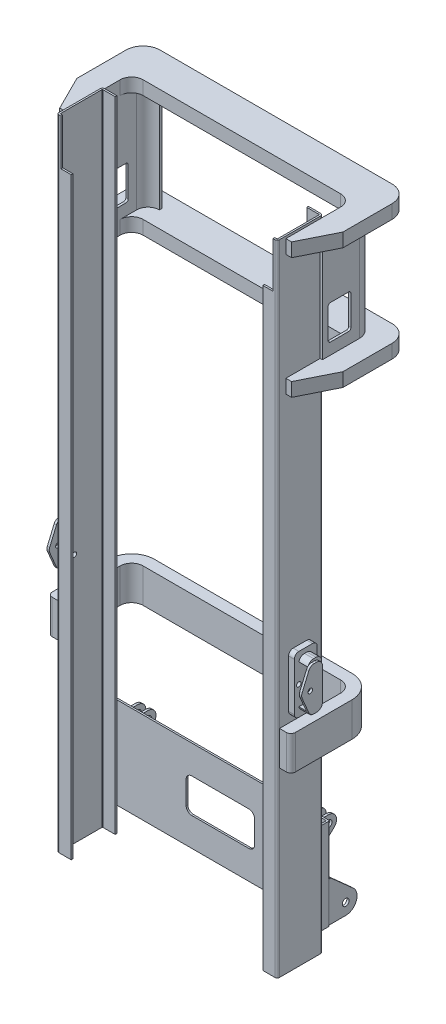
from build123d import *
from build123d.topology import SkipClean

# Parameters (mm, degrees)
EXTRUDE_THIN1_DEPTH     = 1400
CUT_EXTRUDE1_REACH      = 1496.419
SKETCH2_W               = 45
SKETCH2_H               = 200
EXTRUDE_THIN2_START     = -75
EXTRUDE_THIN2_DEPTH     = 400
FILLET2_R               = 5
CUT_EXTRUDE2_REACH      = 1502.296
SKETCH4_W               = 300
SKETCH4_H               = 150
FILLET3_R               = 25
BOSS_EXTRUDE1_START     = -50
SKETCH5_R               = 15
BOSS_EXTRUDE1_DEPTH     = 10
LPATTERN1_COUNT         = 2
LPATTERN1_PITCH         = 45
MIRROR5_START           = -50
MIRROR5_COPY_1_SKETCH_R = 15
MIRROR5_COPY_1_DEPTH    = 10
BOSS_EXTRUDE2_START     = -5
SKETCH6_R               = 15
BOSS_EXTRUDE2_DEPTH     = 10
BOSS_EXTRUDE3_START     = -600
BOSS_EXTRUDE3_DEPTH     = 60
LPATTERN3_COUNT         = 2
LPATTERN3_PITCH         = 530
EXTRUDE_THIN5_REACH     = 2366.397
CUT_EXTRUDE3_REACH      = 1807.73
BOSS_EXTRUDE4_DEPTH     = 25
SKETCH13_W              = 60
SKETCH13_H              = 210
BOSS_EXTRUDE5_DEPTH     = 40
SKETCH14_W              = 20
SKETCH14_H              = 170
CUT_EXTRUDE4_DEPTH      = 40
BOSS_EXTRUDE6_DEPTH     = 10
CUT_EXTRUDE5_REACH      = 1847.201
SKETCH16_R              = 10
FILLET4_R               = 25
FILLET5_R               = 25
MIRROR8_START           = -483
MIRROR8_OUTLINE_R       = 10
MIRROR8_DEPTH           = 966
MIRROR8_START_2         = 483
MIRROR8_2_OUTLINE_R     = 10
MIRROR8_2_DEPTH         = 25
MIRROR8_START_3         = 508
MIRROR8_3_DEPTH         = 40
MIRROR8_START_4         = 548
MIRROR8_4_OUTLINE_R     = 10
MIRROR8_4_DEPTH         = 10
BOSS_EXTRUDE7_START     = 175
SKETCH17_W              = 25
SKETCH17_H              = 60
BOSS_EXTRUDE7_DEPTH     = 150
FILLET6_R               = 20
SKETCH18_W              = 40
SKETCH18_H              = 160
CUT_EXTRUDE6_DEPTH      = 256


# Read off the part's stored shape, not the designer's step: Mirror8
with BuildPart() as part:
    # Sketch1 → Extrude-Thin1 (new, symmetric)
    with BuildSketch(Plane(origin=(0, 0, 0), x_dir=(1, 0, 0), z_dir=(0, 1, 0))):
        with BuildLine():
            Line((420, 100), (473, 100))
            ThreePointArc((473, 100), (480.071067812, 97.071067812), (483, 90))
            Line((483, 90), (483, -90))
            ThreePointArc((483, -90), (480.071067812, -97.071067812), (473, -100))
            Line((473, -100), (420, -100))
            Line((420, -100), (420, -92.5))
            Line((420, -92.5), (473, -92.5))
            ThreePointArc((473, -92.5), (474.767766953, -91.767766953), (475.5, -90))
            Line((475.5, -90), (475.5, 90))
            ThreePointArc((475.5, 90), (474.767766953, 91.767766953), (473, 92.5))
            Line((473, 92.5), (420, 92.5))
            Line((420, 92.5), (420, 100))
        make_face()
    extrude(amount=EXTRUDE_THIN1_DEPTH, both=True)

    # Sketch2 → Cut-Extrude1 (cut, up to next)
    with BuildSketch(Plane.XY.offset(100), mode=Mode.PRIVATE) as cut_extrude1_sk1:
        with Locations((442.5, 1300)):
            Rectangle(SKETCH2_W, SKETCH2_H)
    cut_extrude1_tool1 = extrude(cut_extrude1_sk1.sketch, amount=-CUT_EXTRUDE1_REACH, mode=Mode.PRIVATE) & part.part
    add(cut_extrude1_tool1.solids().sort_by_distance((442.5, 1300, 100))[0], mode=Mode.SUBTRACT)


with BuildPart() as body_2:
    # Mirror4: mirrored copy
    add(part.part.mirror(Plane(origin=(0, 0, 0), x_dir=(0, 0, 1), z_dir=(1, 0, 0))))


with BuildPart() as part_1:
    add(part.part)

    add(body_2.part)  # Extrude-Thin2 merges body 2
    # Sketch3 → Extrude-Thin2 (add)
    with BuildSketch(Plane.XZ.offset(1400).offset(EXTRUDE_THIN2_START)):
        Polygon((-473, -100), (-473, -140), (473, -140), (473, -100), (465.5, -100), (465.5, -132.5), (-465.5, -132.5), (-465.5, -100), align=None)
    extrude(amount=-EXTRUDE_THIN2_DEPTH)

    # Fillet2
    fillet2_edges = [part_1.edges().sort_by_distance(p)[0] for p in [
        (473, -1125, -140),
        (-473, -1125, -140),
    ]]
    fillet(fillet2_edges, radius=FILLET2_R)

    # Sketch4 → Cut-Extrude2 (cut, up to next)
    with BuildSketch(Plane(origin=(0, 0, -140), x_dir=(-1, 0, 0), z_dir=(0, 0, -1)), mode=Mode.PRIVATE) as cut_extrude2_sk1:
        with Locations((-1.25, -1125)):
            Rectangle(SKETCH4_W, SKETCH4_H)
    cut_extrude2_tool1 = extrude(cut_extrude2_sk1.sketch, amount=-CUT_EXTRUDE2_REACH, mode=Mode.PRIVATE) & part_1.part
    add(cut_extrude2_tool1.solids().sort_by_distance((1.25, -1125, -140))[0], mode=Mode.SUBTRACT)

    # Fillet3
    fillet3_edges = [part_1.edges().sort_by_distance(p)[0] for p in [
        (-148.75, -1050, -136.25),
        (-148.75, -1200, -136.25),
        (151.25, -1200, -136.25),
        (151.25, -1050, -136.25),
    ]]
    fillet(fillet3_edges, radius=FILLET3_R)

    # Sketch5 → Boss-Extrude1 (add)
    with BuildSketch(Plane(origin=(473, 0, 0), x_dir=(0, 0, -1), z_dir=(1, 0, 0)).offset(BOSS_EXTRUDE1_START)):
        with BuildLine():
            Line((140, -950), (185, -950))
            ThreePointArc((185, -950), (217.555636783, -972.149688189), (208.905719078, -1010.56397065))
            Line((208.905719078, -1010.56397065), (140, -1075))
            Line((140, -1075), (140, -950))
        make_face()
        with Locations((185, -985)):
            Circle(SKETCH5_R, mode=Mode.SUBTRACT)
    boss_extrude1 = extrude(amount=-BOSS_EXTRUDE1_DEPTH)

    # LPattern1: Boss-Extrude1 ×2
    with Locations(*[(-i * LPATTERN1_PITCH, 0, 0) for i in range(1, LPATTERN1_COUNT)]):
        add(boss_extrude1)

    # Mirror5: Boss-Extrude1 across plane
    add(boss_extrude1.mirror(Plane(origin=(0, 0, 0), x_dir=(0, 0, 1), z_dir=(1, 0, 0))))

    # Mirror5 copy 1 sketch → Mirror5 copy 1 (add)
    with BuildSketch(Plane(origin=(-428, 0, 0), x_dir=(0, 0, -1), z_dir=(-1, 0, 0)).offset(MIRROR5_START)):
        with BuildLine():
            Line((140, 950), (185, 950))
            ThreePointArc((185, 950), (217.555636783, 972.149688189), (208.905719078, 1010.56397065))
            Line((208.905719078, 1010.56397065), (140, 1075))
            Line((140, 1075), (140, 950))
        make_face()
        with Locations((185, 985)):
            Circle(MIRROR5_COPY_1_SKETCH_R, mode=Mode.SUBTRACT)
    extrude(amount=-MIRROR5_COPY_1_DEPTH)

    # Sketch6 → Boss-Extrude2 (add)
    with BuildSketch(Plane(origin=(473, 0, 0), x_dir=(0, 0, -1), z_dir=(1, 0, 0)).offset(BOSS_EXTRUDE2_START)):
        with BuildLine():
            Line((140, -1325), (215, -1325))
            ThreePointArc((215, -1325), (261.719701801, -1292.812059501), (248.286964333, -1237.690778547))
            Line((248.286964333, -1237.690778547), (150, -1150))
            Line((150, -1150), (140, -1150))
            Line((140, -1150), (140, -1325))
        make_face()
        with Locations((215, -1275)):
            Circle(SKETCH6_R, mode=Mode.SUBTRACT)
    boss_extrude2 = extrude(amount=-BOSS_EXTRUDE2_DEPTH)

    # Mirror6: Boss-Extrude2 across plane
    add(boss_extrude2.mirror(Plane(origin=(0, 0, 0), x_dir=(0, 0, 1), z_dir=(1, 0, 0))))

    # Sketch8 → Boss-Extrude3 (add)
    with BuildSketch(Plane(origin=(0, 1400, 0), x_dir=(1, 0, 0), z_dir=(0, 1, 0)).offset(BOSS_EXTRUDE3_START)):
        with BuildLine():
            Line((-483, -62), (-508, -62))
            Line((-508, -62), (-583, 88))
            Line((-583, 88), (-583, 303))
            ThreePointArc((-583, 303), (-561.033008589, 356.033008589), (-508, 378))
            Line((-508, 378), (508, 378))
            ThreePointArc((508, 378), (561.033008589, 356.033008589), (583, 303))
            Line((583, 303), (583, 88))
            Line((583, 88), (508, -62))
            Line((508, -62), (483, -62))
            Line((483, -62), (483, 178))
            ThreePointArc((483, 178), (468.355339059, 213.355339059), (433, 228))
            Line((433, 228), (-433, 228))
            ThreePointArc((-433, 228), (-468.355339059, 213.355339059), (-483, 178))
            Line((-483, 178), (-483, -62))
        make_face()
    boss_extrude3 = extrude(amount=BOSS_EXTRUDE3_DEPTH)

    # LPattern3: Boss-Extrude3 ×2
    with Locations(*[(0, i * LPATTERN3_PITCH, 0) for i in range(1, LPATTERN3_COUNT)]):
        add(boss_extrude3)

    # Sketch9 → Extrude-Thin5 (add, up to next)
    with BuildSketch(Plane(origin=(0, 860, 0), x_dir=(1, 0, 0), z_dir=(0, 1, 0)), mode=Mode.PRIVATE) as extrude_thin5_sk1:
        with BuildLine():
            Line((483, 88), (483, 250))
            ThreePointArc((483, 250), (468.355339059, 285.355339059), (433, 300))
            Line((433, 300), (433, 310))
            ThreePointArc((433, 310), (475.426406871, 292.426406871), (493, 250))
            Line((493, 250), (493, 88))
            Line((493, 88), (483, 88))
        make_face()
    extrude_thin5_tool1 = extrude(extrude_thin5_sk1.sketch, amount=EXTRUDE_THIN5_REACH, mode=Mode.PRIVATE) - part_1.part
    extrude_thin5 = extrude_thin5_tool1.solids().sort_by_distance((490.700348, 860, -169))[0]
    add(extrude_thin5)

    # Sketch11 → Cut-Extrude3 (cut, up to next)
    with BuildSketch(Plane(origin=(493, 0, 0), x_dir=(0, 0, -1), z_dir=(1, 0, 0)), mode=Mode.PRIVATE) as cut_extrude3_sk1:
        with BuildLine():
            Line((123, 910), (203, 910))
            ThreePointArc((203, 910), (210.071067812, 912.928932188), (213, 920))
            Line((213, 920), (213, 1050))
            ThreePointArc((213, 1050), (210.071067812, 1057.071067812), (203, 1060))
            Line((203, 1060), (123, 1060))
            ThreePointArc((123, 1060), (115.928932188, 1057.071067812), (113, 1050))
            Line((113, 1050), (113, 920))
            ThreePointArc((113, 920), (115.928932188, 912.928932188), (123, 910))
        make_face()
    cut_extrude3_tool1 = extrude(cut_extrude3_sk1.sketch, amount=-CUT_EXTRUDE3_REACH, mode=Mode.PRIVATE) & part_1.part
    cut_extrude3 = cut_extrude3_tool1.solids().sort_by_distance((493, 985, -163))[0]
    add(cut_extrude3, mode=Mode.SUBTRACT)

    # Mirror7: Extrude-Thin5, Cut-Extrude3 across plane
    add(extrude_thin5.mirror(Plane(origin=(0, 0, 0), x_dir=(0, 0, 1), z_dir=(1, 0, 0))))
    add(cut_extrude3.mirror(Plane(origin=(0, 0, 0), x_dir=(0, 0, 1), z_dir=(1, 0, 0))), mode=Mode.SUBTRACT)

    # Sketch12 → Boss-Extrude4 (add)
    with BuildSketch(Plane.ZY.offset(483)):
        with BuildLine():
            Line((-30, -430), (30, -430))
            ThreePointArc((30, -430), (44.142135624, -424.142135624), (50, -410))
            Line((50, -410), (50, -200))
            ThreePointArc((50, -200), (44.142135624, -185.857864376), (30, -180))
            Line((30, -180), (-30, -180))
            ThreePointArc((-30, -180), (-44.142135624, -185.857864376), (-50, -200))
            Line((-50, -200), (-50, -410))
            ThreePointArc((-50, -410), (-44.142135624, -424.142135624), (-30, -430))
        make_face()
    extrude(amount=BOSS_EXTRUDE4_DEPTH)

    # Sketch13 → Boss-Extrude5 (add)
    with BuildSketch(Plane.ZY.offset(508)):
        with Locations((0, -305)):
            Rectangle(SKETCH13_W, SKETCH13_H)
    extrude(amount=BOSS_EXTRUDE5_DEPTH)

    # Sketch14 → Cut-Extrude4 (cut)
    with BuildSketch(Plane.ZY.offset(548)):
        with Locations((20, -305)):
            Rectangle(SKETCH14_W, SKETCH14_H)
        with Locations((0, -305)):
            Rectangle(SKETCH14_W, SKETCH14_H)
    extrude(amount=-CUT_EXTRUDE4_DEPTH, mode=Mode.SUBTRACT)

    # Sketch15 → Boss-Extrude6 (add)
    with BuildSketch(Plane.ZY.offset(548)):
        Polygon((30, -210), (70.265063544, -305), (30, -400), (-22.972326384, -400), (-22.972326384, -210), align=None)
    extrude(amount=BOSS_EXTRUDE6_DEPTH)

    # Cut-Extrude5: up to this face of the body (flat: up to its plane)
    cut_extrude5_end = Plane(part_1.part.faces().sort_by_distance((-483, -29.297911964, 0.736738357))[0])
    # Sketch16 → Cut-Extrude5 (cut, up to the picked face)
    with BuildSketch(Plane.ZY.offset(558), mode=Mode.PRIVATE) as cut_extrude5_sk1:
        with Locations((30.265063544, -305)):
            Circle(SKETCH16_R)
    cut_extrude5_tool1 = split(extrude(cut_extrude5_sk1.sketch, amount=-CUT_EXTRUDE5_REACH, mode=Mode.PRIVATE), bisect_by=cut_extrude5_end, keep=Keep.BOTH, mode=Mode.PRIVATE)
    add(cut_extrude5_tool1.solids().sort_by(Axis((-558, -305, 30.265064), (1, 0, 0)))[0], mode=Mode.SUBTRACT)

    # Fillet4
    # the kernel refuses this fillet: 25 mm, written as the material it takes off along each edge
    with BuildSketch(Plane(origin=(-548, -210, 30), x_dir=(0, 0, -1), z_dir=(-1, 0, 0))) as fillet4_piece_1:
        with BuildLine():
            CenterArc((FILLET4_R * 0.662270800578, FILLET4_R), FILLET4_R, 202.969308404, 67.030691596)
            Line((-FILLET4_R * 0.258443223512, FILLET4_R * 0.609762013838), (0, 0))
            Line((0, 0), (FILLET4_R * 0.662270800578, 0))
        make_face()
    extrude(amount=51.391925036, mode=Mode.SUBTRACT)
    with BuildSketch(Plane(origin=(-548, -210, -22.972326384), x_dir=(0, 0, 1), z_dir=(-1, 0, 0)), Plane(origin=(-548, -400, -22.972326384), x_dir=(0, 1, 0), z_dir=(-1, 0, 0))) as fillet4_piece_2:
        with BuildLine():
            CenterArc((FILLET4_R, -FILLET4_R), FILLET4_R, 90, 90)
            Line((0, -FILLET4_R), (0, 0))
            Line((0, 0), (FILLET4_R, 0))
        make_face()
    extrude(amount=72.5, mode=Mode.SUBTRACT)
    with BuildSketch(Plane(origin=(-548, -400, 30), x_dir=(0, 0, -1), z_dir=(-1, 0, 0))) as fillet4_piece_3:
        with BuildLine():
            CenterArc((FILLET4_R * 0.662270800578, -FILLET4_R), FILLET4_R, 90, 67.030691596)
            Line((-FILLET4_R * 0.258443223512, -FILLET4_R * 0.609762013838), (0, 0))
            Line((0, 0), (FILLET4_R * 0.662270800578, 0))
        make_face()
    extrude(amount=51.391925036, mode=Mode.SUBTRACT)
    with BuildSketch(Plane(origin=(-521.509826616, -305, 70.265063544), x_dir=(0, 0.9207140240900884, -0.3902379861620805), z_dir=(-1, 0, 0))) as fillet4_piece_4:
        with BuildLine():
            CenterArc((FILLET4_R * 0.423842774142, FILLET4_R), FILLET4_R, 224.061383193, 45.938616807)
            Line((-FILLET4_R * 0.294752399042, FILLET4_R * 0.304571371688), (0, 0))
            Line((0, 0), (FILLET4_R * 0.423842774142, 0))
        make_face()
    extrude(amount=62.980346768, mode=Mode.SUBTRACT)

    # Fillet5
    # the kernel refuses this fillet: 25 mm, written as the material it takes off along each edge
    with BuildSketch(Plane(origin=(-508, -410, 30), x_dir=(0, 1, 0), z_dir=(-1, 0, 0))) as fillet5_piece_1:
        with BuildLine():
            CenterArc((25, 24.494897428), FILLET5_R, 180, 78.463040967)
            Line((0, 24.494897428), (0, 0))
            Line((0, 0), (20, 0))
        make_face()
    extrude(amount=40, mode=Mode.SUBTRACT)
    with BuildSketch(Plane(origin=(-508, -200, 30), x_dir=(0, 0, -1), z_dir=(-1, 0, 0))) as fillet5_piece_2:
        with BuildLine():
            CenterArc((24.494897428, 25), FILLET5_R, 191.536959033, 78.463040967)
            Line((0, 20), (0, 0))
            Line((0, 0), (24.494897428, 0))
        make_face()
    extrude(amount=40, mode=Mode.SUBTRACT)
    with BuildSketch(Plane(origin=(-508, -200, -30), x_dir=(0, -1, 0), z_dir=(-1, 0, 0)), Plane(origin=(-508, -410, -30), x_dir=(0, 0, 1), z_dir=(-1, 0, 0))) as fillet5_piece_3:
        with BuildLine():
            CenterArc((FILLET5_R, FILLET5_R), FILLET5_R, 180, 90)
            Line((0, FILLET5_R), (0, 0))
            Line((0, 0), (FILLET5_R, 0))
        make_face()
    extrude(amount=102.5, mode=Mode.SUBTRACT)

    # Mirror8 outline → Mirror8 (cut)
    with SkipClean():  # the faces are left unmerged after this step: merging them gives an invalid solid
        with BuildSketch(Plane.YZ.offset(MIRROR8_START)):
            with Locations((-305, 30.265063544)):
                Circle(MIRROR8_OUTLINE_R)
        extrude(amount=MIRROR8_DEPTH, mode=Mode.SUBTRACT)

    # Mirror8 2 outline → Mirror8 2 (add)
    with SkipClean():  # the faces are left unmerged after this step: merging them gives an invalid solid
        with BuildSketch(Plane.YZ.offset(MIRROR8_START_2)):
            with BuildLine():
                ThreePointArc((-430, -30), (-424.142135624, -44.142135624), (-410, -50))
                Line((-410, -50), (-200, -50))
                ThreePointArc((-200, -50), (-185.857864376, -44.142135624), (-180, -30))
                Line((-180, -30), (-180, 30))
                ThreePointArc((-180, 30), (-185.857864376, 44.142135624), (-200, 50))
                Line((-200, 50), (-410, 50))
                ThreePointArc((-410, 50), (-424.142135624, 44.142135624), (-430, 30))
                Line((-430, 30), (-430, -30))
            make_face()
            with Locations((-305, 30.265063544)):
                Circle(MIRROR8_2_OUTLINE_R, mode=Mode.SUBTRACT)
        extrude(amount=MIRROR8_2_DEPTH)

    # Mirror8 3 outline → Mirror8 3 (add)
    with SkipClean():  # the faces are left unmerged after this step: merging them gives an invalid solid
        with BuildSketch(Plane.YZ.offset(MIRROR8_START_3)):
            with BuildLine():
                ThreePointArc((-390, 30), (-404.364916731, 21.316490873), (-410, 5.505102572))
                Line((-410, 5.505102572), (-410, -5))
                ThreePointArc((-410, -5), (-402.67766953, -22.67766953), (-385, -30))
                Line((-385, -30), (-225, -30))
                ThreePointArc((-225, -30), (-207.32233047, -22.67766953), (-200, -5))
                Line((-200, -5), (-200, 5.505102572))
                ThreePointArc((-200, 5.505102572), (-205.635083269, 21.316490873), (-220, 30))
                Line((-220, 30), (-220, -10))
                Line((-220, -10), (-390, -10))
                Line((-390, -10), (-390, 30))
            make_face()
        extrude(amount=MIRROR8_3_DEPTH)

    # Mirror8 4 outline → Mirror8 4 (add)
    with SkipClean():  # the faces are left unmerged after this step: merging them gives an invalid solid
        with BuildSketch(Plane.YZ.offset(MIRROR8_START_4)):
            with BuildLine():
                Line((-314.755949654, 66.130074778), (-384.755949654, 36.461080588))
                ThreePointArc((-384.755949654, 36.461080588), (-395.843449107, 27.247237713), (-400, 13.443229986))
                Line((-400, 13.443229986), (-400, 2.027673616))
                ThreePointArc((-400, 2.027673616), (-392.67766953, -15.649995914), (-375, -22.972326384))
                Line((-375, -22.972326384), (-235, -22.972326384))
                ThreePointArc((-235, -22.972326384), (-217.32233047, -15.649995914), (-210, 2.027673616))
                Line((-210, 2.027673616), (-210, 13.443229986))
                ThreePointArc((-210, 13.443229986), (-214.156550893, 27.247237713), (-225.244050346, 36.461080588))
                Line((-225.244050346, 36.461080588), (-295.244050346, 66.130074778))
                ThreePointArc((-295.244050346, 66.130074778), (-305, 68.112224176), (-314.755949654, 66.130074778))
            make_face()
            with Locations((-305, 30.265063544)):
                Circle(MIRROR8_4_OUTLINE_R, mode=Mode.SUBTRACT)
        extrude(amount=MIRROR8_4_DEPTH)

    # Sketch17 → Boss-Extrude7 (add)
    with SkipClean():  # the faces are left unmerged after this step: merging them gives an invalid solid
        with BuildSketch(Plane.XZ.offset(430).offset(BOSS_EXTRUDE7_START)):
            with BuildLine():
                Line((-483, -178), (-483, -90))
                Line((-483, -90), (-483, 90))
                Line((-483, 90), (-533, 90))
                Line((-533, 90), (-533, -90))
                Line((-533, -90), (-533, -178))
                ThreePointArc((-533, -178), (-503.710678119, -248.710678119), (-433, -278))
                Line((-433, -278), (433, -278))
                ThreePointArc((433, -278), (503.710678119, -248.710678119), (533, -178))
                Line((533, -178), (533, -90))
                Line((533, -90), (533, 90))
                Line((533, 90), (483, 90))
                Line((483, 90), (483, 30))
                Line((483, 30), (508, 30))
                Line((508, 30), (508, -30))
                Line((508, -30), (483, -30))
                Line((483, -30), (483, -90))
                Line((483, -90), (483, -178))
                ThreePointArc((483, -178), (468.355339059, -213.355339059), (433, -228))
                Line((433, -228), (-433, -228))
                ThreePointArc((-433, -228), (-468.355339059, -213.355339059), (-483, -178))
            make_face()
            with Locations((495.5, 0)):
                Rectangle(SKETCH17_W, SKETCH17_H)
        extrude(amount=-BOSS_EXTRUDE7_DEPTH)
    add(part_1.part.scale(1), mode=Mode.REPLACE)  # the faces are merged on a copy

    # Fillet6
    fillet6_edges = [part_1.edges().sort_by_distance(p)[0] for p in [
        (-533, -530, 90),
        (533, -530, 90),
    ]]
    fillet(fillet6_edges, radius=FILLET6_R)

    # Sketch18 → Cut-Extrude6 (cut)
    with SkipClean():  # the faces are left unmerged after this step: merging them gives an invalid solid
        with BuildSketch(Plane(origin=(0, 0, -30), x_dir=(-1, 0, 0), z_dir=(0, 0, -1))):
            with Locations((-528, -305)):
                Rectangle(SKETCH18_W, SKETCH18_H)
            with Locations((528, -305)):
                Rectangle(SKETCH18_W, SKETCH18_H)
        extrude(amount=-CUT_EXTRUDE6_DEPTH, mode=Mode.SUBTRACT)


solid = part_1.part
